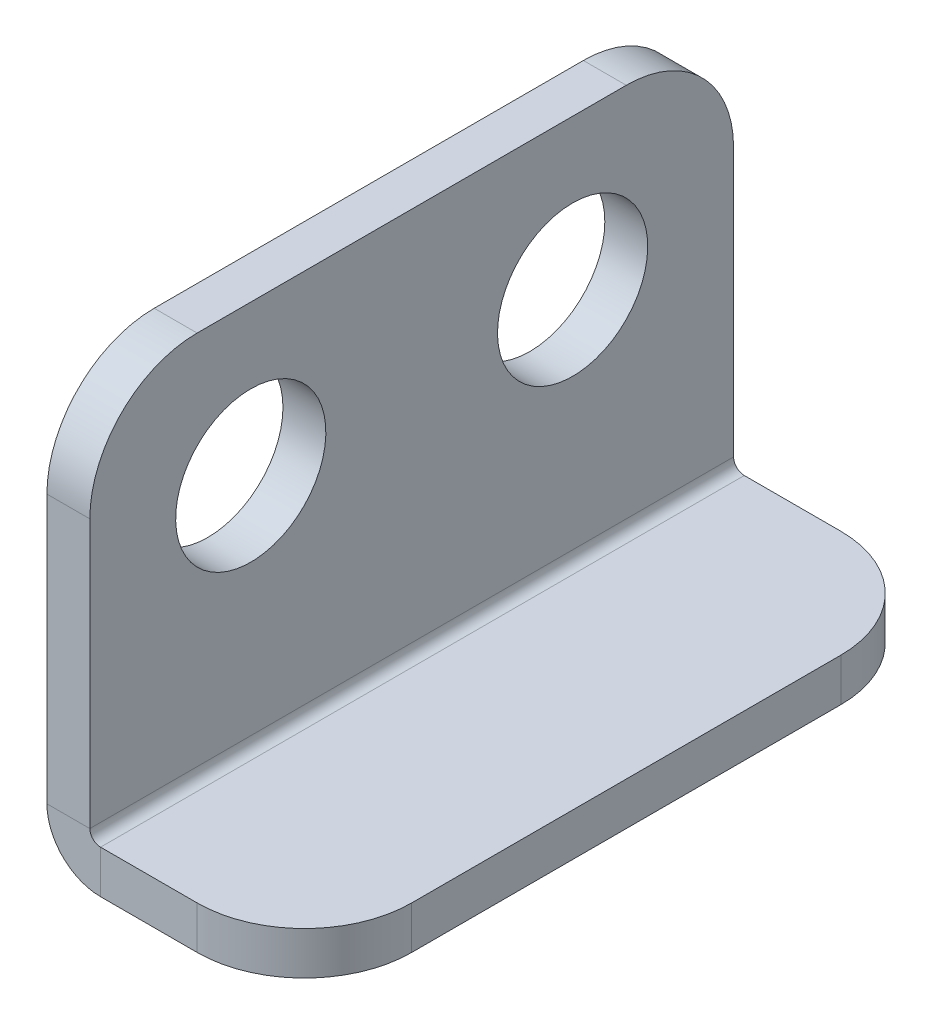
from build123d import *

# Parameters (mm, degrees)
SM_BASE_FLANGE_1_DEPTH = 15
CUT_EXTRUDE_1_REACH    = 28.926
SKETCH_3_R             = 3.5
FILLET_1_R             = 5


# Sheet-metal steps are written as plain solids
with BuildPart() as part:
    # Sketch 1 → 基体-法兰1 (new, symmetric)
    with BuildSketch(Plane.XY):
        with BuildLine():
            Line((0, 20), (0, 2.5))
            ThreePointArc((0, 2.5), (0.732233047, 0.732233047), (2.5, 0))
            Line((2.5, 0), (12, 0))
            Line((12, 0), (12, 2))
            Line((12, 2), (2.5, 2))
            ThreePointArc((2.5, 2), (2.146446609, 2.146446609), (2, 2.5))
            Line((2, 2.5), (2, 20))
            Line((2, 20), (0, 20))
        make_face()
    extrude(amount=SM_BASE_FLANGE_1_DEPTH, both=True)

    # 草图3 → 切除-拉伸1 (cut, up to next)
    with BuildSketch(Plane(origin=(2, 0, 0), x_dir=(0, 0, -1), z_dir=(1, 0, 0)), mode=Mode.PRIVATE) as cut_extrude_1_sk1:
        with Locations(Location((-7.5, 13, 0), (0, 0, 90))):
            Circle(SKETCH_3_R)
    cut_extrude_1_tool1 = extrude(cut_extrude_1_sk1.sketch, amount=-CUT_EXTRUDE_1_REACH, mode=Mode.PRIVATE) & part.part
    # 草图3 → 切除-拉伸1 (cut, up to next)
    with BuildSketch(Plane(origin=(2, 0, 0), x_dir=(0, 0, -1), z_dir=(1, 0, 0)), mode=Mode.PRIVATE) as cut_extrude_1_sk2:
        with Locations(Location((7.5, 13, 0), (0, 0, 90))):
            Circle(SKETCH_3_R)
    cut_extrude_1_tool2 = extrude(cut_extrude_1_sk2.sketch, amount=-CUT_EXTRUDE_1_REACH, mode=Mode.PRIVATE) & part.part
    add(cut_extrude_1_tool1.solids().sort_by_distance((2, 13, 7.5))[0], mode=Mode.SUBTRACT)
    add(cut_extrude_1_tool2.solids().sort_by_distance((2, 13, -7.5))[0], mode=Mode.SUBTRACT)

    # 圆角1
    fillet_1_edges = [part.edges().sort_by_distance(p)[0] for p in [
        (1, 20, -15),
        (12, 1, -15),
        (1, 20, 15),
        (12, 1, 15),
    ]]
    fillet(fillet_1_edges, radius=FILLET_1_R)


solid = part.part
